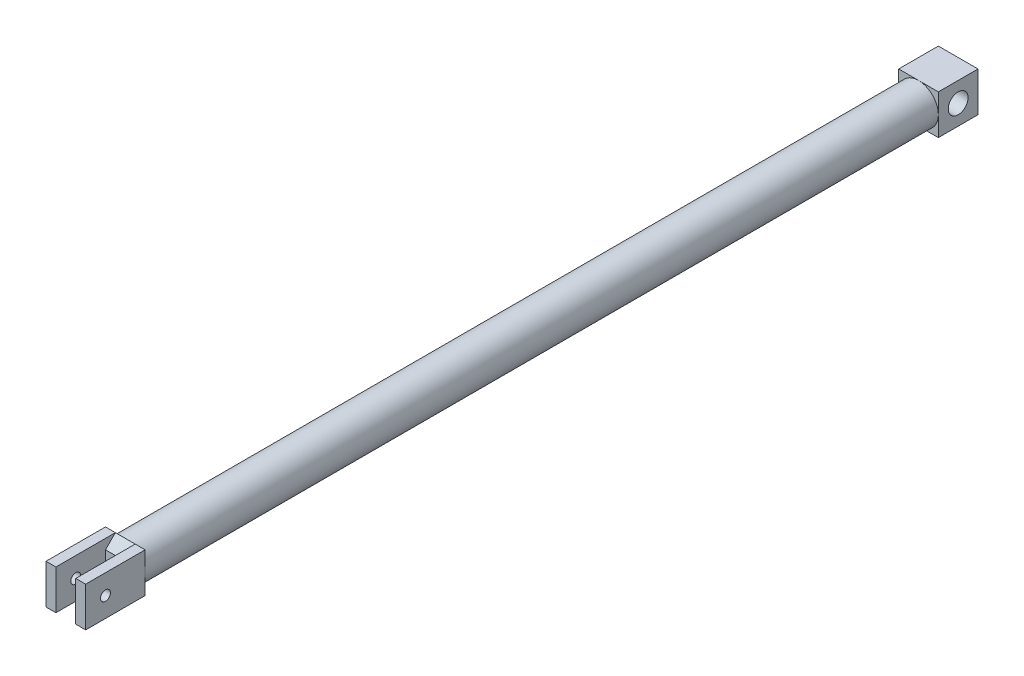
from build123d import *

# Parameters (mm, degrees)
SKIZZE1_R                       = 10
AUFSATZ_LINEAR_AUSTRAGEN1_DEPTH = 400
SKIZZE2_W                       = 20
SKIZZE2_H                       = 20
AUFSATZ_LINEAR_AUSTRAGEN2_DEPTH = 20
SKIZZE3_R                       = 5
SCHNITT_LINEAR_AUSTRAGEN1_DEPTH = 30
SKIZZE4_W                       = 20
SKIZZE4_H                       = 20
AUFSATZ_LINEAR_AUSTRAGEN3_DEPTH = 30
SKIZZE5_W                       = 10
SKIZZE5_H                       = 20
SCHNITT_LINEAR_AUSTRAGEN2_DEPTH = 25
FASE1_SIZE                      = 5
SKIZZE6_R                       = 2.5
SCHNITT_LINEAR_AUSTRAGEN3_DEPTH = 25


with BuildPart() as part:
    # Skizze1 → Aufsatz-Linear austragen1 (new body)
    with BuildSketch(Plane.XY):
        Circle(SKIZZE1_R)
    extrude(amount=AUFSATZ_LINEAR_AUSTRAGEN1_DEPTH)

    # Skizze2 → Aufsatz-Linear austragen2 (add)
    with BuildSketch(Plane(origin=(0, 0, 0), x_dir=(-1, 0, 0), z_dir=(0, 0, -1))):
        Rectangle(SKIZZE2_W, SKIZZE2_H)
    extrude(amount=AUFSATZ_LINEAR_AUSTRAGEN2_DEPTH)

    # Skizze3 → Schnitt-Linear austragen1 (cut)
    with BuildSketch(Plane(origin=(10, 0, 0), x_dir=(0, 0, -1), z_dir=(1, 0, 0))):
        with Locations(Location((10, 0, 0), (0, 0, 90))):
            Circle(SKIZZE3_R)
    extrude(amount=-SCHNITT_LINEAR_AUSTRAGEN1_DEPTH, mode=Mode.SUBTRACT)

    # Skizze4 → Aufsatz-Linear austragen3 (add)
    with BuildSketch(Plane.XY.offset(400)):
        Rectangle(SKIZZE4_W, SKIZZE4_H)
    extrude(amount=AUFSATZ_LINEAR_AUSTRAGEN3_DEPTH)

    # Skizze5 → Schnitt-Linear austragen2 (cut)
    with BuildSketch(Plane.XY.offset(430)):
        Rectangle(SKIZZE5_W, SKIZZE5_H)
    extrude(amount=-SCHNITT_LINEAR_AUSTRAGEN2_DEPTH, mode=Mode.SUBTRACT)

    # Fase1
    fase1_edges = [part.edges().sort_by_distance(p)[0] for p in [
        (0, -10, 405),
        (0, 10, 405),
    ]]
    chamfer(fase1_edges, length=FASE1_SIZE - 0.0001)  # a hair under: the kernel refuses the full size

    # Skizze6 → Schnitt-Linear austragen3 (cut)
    with BuildSketch(Plane(origin=(10, 0, 0), x_dir=(0, 0, -1), z_dir=(1, 0, 0))):
        with Locations((-420, 0)):
            Circle(SKIZZE6_R)
    extrude(amount=-SCHNITT_LINEAR_AUSTRAGEN3_DEPTH, mode=Mode.SUBTRACT)


solid = part.part
